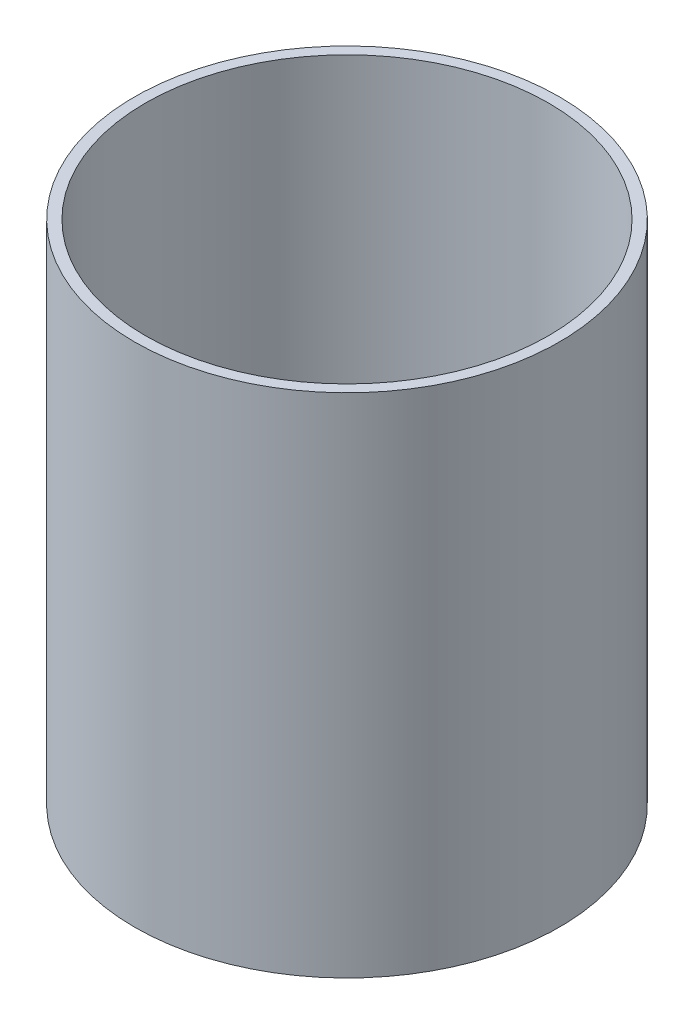
from build123d import *

# Parameters (mm, degrees)
SKETCH1_R           = 93.6625
SKETCH1_R_2         = 88.9
BOSS_EXTRUDE1_DEPTH = 111.76


with BuildPart() as part:
    # Sketch1 → Boss-Extrude1 (new, symmetric)
    with BuildSketch(Plane(origin=(0, 0, 0), x_dir=(1, 0, 0), z_dir=(0, 1, 0))):
        Circle(SKETCH1_R)
        Circle(SKETCH1_R_2, mode=Mode.SUBTRACT)
    extrude(amount=BOSS_EXTRUDE1_DEPTH, both=True)


solid = part.part
